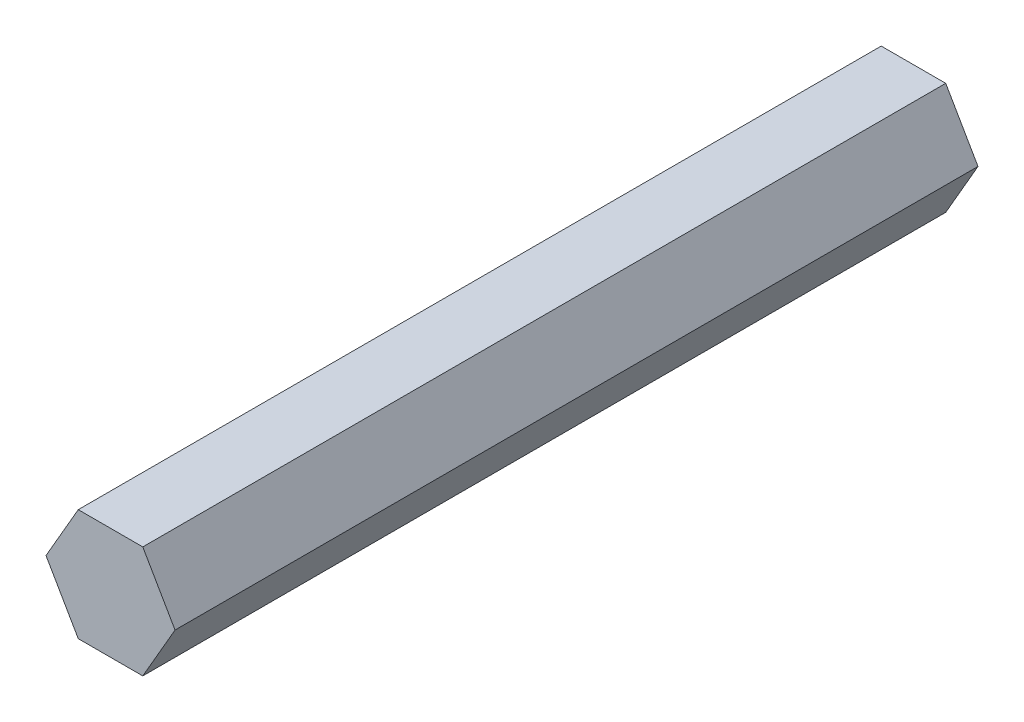
from build123d import *

# Parameters (mm, degrees)
BOSS_EXTRUDE1_DEPTH = 91.25


with BuildPart() as part:
    # Sketch1 → Boss-Extrude1 (new body)
    with BuildSketch(Plane.XY):
        Polygon((7.332348419, 0), (3.666174209, 6.35), (-3.666174209, 6.35), (-7.332348419, 0), (-3.666174209, -6.35), (3.666174209, -6.35), align=None)
    extrude(amount=BOSS_EXTRUDE1_DEPTH)


solid = part.part
